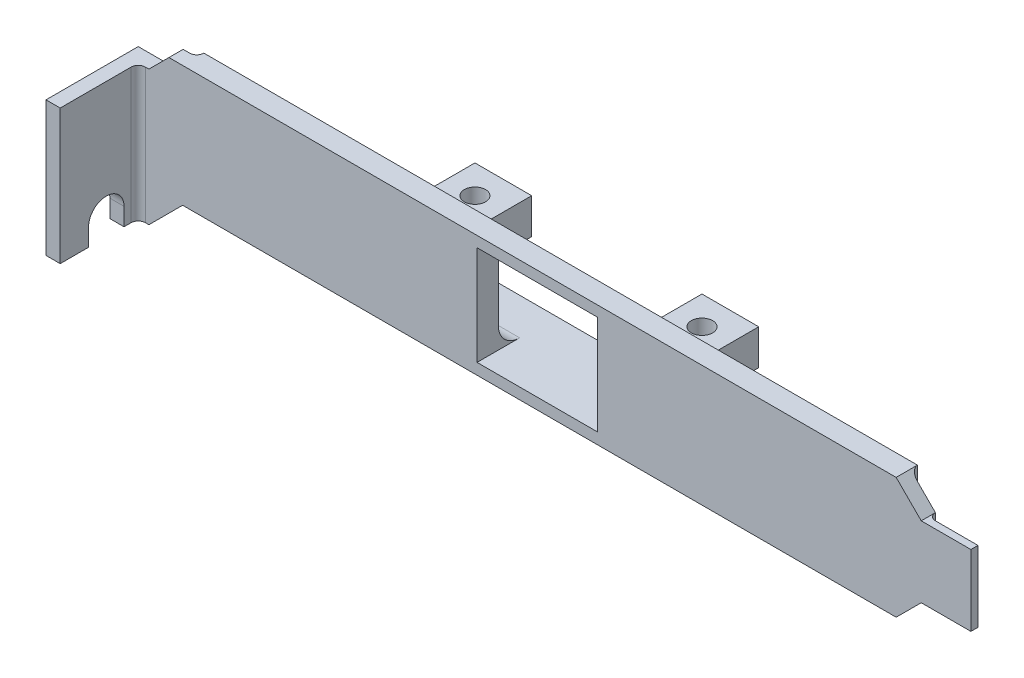
from build123d import *

# Parameters (mm, degrees)
CUT_EXTRUDE_1_DEPTH       = 2
CUT_EXTRUDE_START         = 9
CUT_EXTRUDE_1_2_OUTLINE_W = 2
CUT_EXTRUDE_1_2_OUTLINE_H = 19
CUT_EXTRUDE_1_2_DEPTH     = 4
CUT_EXTRUDE_START_2       = 2
CUT_EXTRUDE_1_3_OUTLINE_W = 2
CUT_EXTRUDE_1_3_OUTLINE_H = 19
CUT_EXTRUDE_1_3_DEPTH     = 2
CUT_EXTRUDE_START_3       = -49.585786703
CUT_EXTRUDE_1_4_DEPTH     = 2
CUT_EXTRUDE_START_4       = -5.128602194
CUT_EXTRUDE_1_5_DEPTH     = 19
SKETCH_3_W                = 100.571067812
SKETCH_3_H                = 17.071067812
EXTRUDE_1_DEPTH           = 1
CUT_EXTRUDE_2_REACH       = 75.102
SKETCH_4_W                = 17
SKETCH_4_H                = 14
SKETCH_5_W                = 8
SKETCH_5_H                = 5
SKETCH_5_W_2              = 47
SKETCH_5_H_2              = 1.571067812
EXTRUDE_2_DEPTH           = 8.2
CUT_EXTRUDE_3_REACH       = 75.563
SKETCH_6_R                = 1.5
FILLET_1_R                = 1
FILLET_2_R                = 3
SKETCH_8_W                = 7
SKETCH_8_H                = 10
CUT_EXTRUDE_4_DEPTH       = 1
FILLET_3_R                = 1


with BuildPart() as part:
    # 切除-拉伸1: read off the stored shape, not the designer's step
    # 切除-拉伸1 outline → 切除-拉伸1 (new body)
    with BuildSketch(Plane.XY):
        Polygon((-49.585786703, 13.871397806), (-49.585786703, -5.128602194), (-46.085786703, -5.128602194), (-41.32842739, -0.371242882), (59.242640422, -0.371242882), (62.778174328, 3.164291024), (69.778174328, 3.164291024), (69.778174328, 13.164291024), (62.778174328, 13.164291024), (59.242640422, 16.69982493), (-43.257359578, 16.69982493), (-46.085786703, 13.871397806), align=None)
    extrude(amount=CUT_EXTRUDE_1_DEPTH)

    # Cut-Extrude 1 3 outline → Cut-Extrude 1 3 (add)
    with BuildSketch(Plane.XY.offset(CUT_EXTRUDE_START_2)):
        with Locations((-48.585786703, 4.371397806)):
            Rectangle(CUT_EXTRUDE_1_3_OUTLINE_W, CUT_EXTRUDE_1_3_OUTLINE_H)
    extrude(amount=CUT_EXTRUDE_1_3_DEPTH)



with BuildPart() as body_2:
    # Cut-Extrude 1 2 outline → Cut-Extrude 1 2 (new body)
    with BuildSketch(Plane.XY.offset(CUT_EXTRUDE_START)):
        with Locations((-48.585786703, 4.371397806)):
            Rectangle(CUT_EXTRUDE_1_2_OUTLINE_W, CUT_EXTRUDE_1_2_OUTLINE_H)
    extrude(amount=CUT_EXTRUDE_1_2_DEPTH)


with BuildPart() as part_1:
    add(part.part)

    add(body_2.part)  # Cut-Extrude 1 4 merges body 2
    # Cut-Extrude 1 4 outline → Cut-Extrude 1 4 (add)
    with BuildSketch(Plane.YZ.offset(CUT_EXTRUDE_START_3)):
        with BuildLine():
            Line((13.871397806, 9), (-2.628602194, 9))
            ThreePointArc((-2.628602194, 9), (-0.128602194, 6.5), (-2.628602194, 4))
            Line((-2.628602194, 4), (13.871397806, 4))
            Line((13.871397806, 4), (13.871397806, 9))
        make_face()
    extrude(amount=CUT_EXTRUDE_1_4_DEPTH)

    # Cut-Extrude 1 5 outline → Cut-Extrude 1 5 (add)
    with BuildSketch(Plane(origin=(0, 0, 0), x_dir=(1, 0, 0), z_dir=(0, 1, 0)).offset(CUT_EXTRUDE_START_4)):
        with BuildLine():
            ThreePointArc((-47.585786703, -3), (-47.292893484, -2.292893219), (-46.585786703, -2))
            Line((-46.585786703, -2), (-47.585786703, -2))
            Line((-47.585786703, -2), (-47.585786703, -3))
        make_face()
    extrude(amount=CUT_EXTRUDE_1_5_DEPTH)

    # 草图3 → 凸台-拉伸1 (add)
    with BuildSketch(Plane(origin=(0, 0, 0), x_dir=(-1, 0, 0), z_dir=(0, 0, -1))):
        with Locations((-8.957106516, 8.164291024)):
            Rectangle(SKETCH_3_W, SKETCH_3_H)
    extrude(amount=EXTRUDE_1_DEPTH)

    # 草图4 → 切除-拉伸2 (cut, up to next)
    with BuildSketch(Plane(origin=(0, 0, -1), x_dir=(-1, 0, 0), z_dir=(0, 0, -1)), mode=Mode.PRIVATE) as cut_extrude_2_sk1:
        with Locations((-8.67157261, 8.19982493)):
            Rectangle(SKETCH_4_W, SKETCH_4_H)
    cut_extrude_2_tool1 = extrude(cut_extrude_2_sk1.sketch, amount=-CUT_EXTRUDE_2_REACH, mode=Mode.PRIVATE) & part_1.part
    add(cut_extrude_2_tool1.solids().sort_by_distance((8.671573, 8.199825, -1))[0], mode=Mode.SUBTRACT)

    # 草图5 → 凸台-拉伸2 (add)
    with BuildSketch(Plane(origin=(0, 0, -1), x_dir=(-1, 0, 0), z_dir=(0, 0, -1))):
        with Locations((-24.67157261, 11.69982493)):
            Rectangle(SKETCH_5_W, SKETCH_5_H)
        with Locations((7.32842739, 11.69982493)):
            Rectangle(SKETCH_5_W, SKETCH_5_H)
        with Locations((-8.67157261, 0.414291024)):
            Rectangle(SKETCH_5_W_2, SKETCH_5_H_2)
    extrude(amount=EXTRUDE_2_DEPTH)

    # 草图6 → 切除-拉伸3 (cut, up to next)
    with BuildSketch(Plane(origin=(0, 14.19982493, 0), x_dir=(1, 0, 0), z_dir=(0, 1, 0)), mode=Mode.PRIVATE) as cut_extrude_3_sk1:
        with Locations(Location((-7.32842739, 5.2, 0), (0, 0, 270))):
            Circle(SKETCH_6_R)
    cut_extrude_3_tool1 = extrude(cut_extrude_3_sk1.sketch, amount=-CUT_EXTRUDE_3_REACH, mode=Mode.PRIVATE) & part_1.part
    # 草图6 → 切除-拉伸3 (cut, up to next)
    with BuildSketch(Plane(origin=(0, 14.19982493, 0), x_dir=(1, 0, 0), z_dir=(0, 1, 0)), mode=Mode.PRIVATE) as cut_extrude_3_sk2:
        with Locations(Location((24.67157261, 5.2, 0), (0, 0, 270))):
            Circle(SKETCH_6_R)
    cut_extrude_3_tool2 = extrude(cut_extrude_3_sk2.sketch, amount=-CUT_EXTRUDE_3_REACH, mode=Mode.PRIVATE) & part_1.part
    add(cut_extrude_3_tool1.solids().sort_by_distance((-7.328427, 14.199825, -5.2))[0], mode=Mode.SUBTRACT)
    add(cut_extrude_3_tool2.solids().sort_by_distance((24.671573, 14.199825, -5.2))[0], mode=Mode.SUBTRACT)

    # 圆角1
    fillet_1_edges = [part_1.edges().sort_by_distance(p)[0] for p in [
        (59.242640422, 8.164291024, 0),
        (-41.32842739, 8.164291024, 0),
    ]]
    fillet(fillet_1_edges, radius=FILLET_1_R - 0.0001)  # a hair under: the kernel refuses the full size

    # 圆角2
    fillet_2_edges = [part_1.edges().sort_by_distance(p)[0] for p in [
        (-7.32842739, 1.19982493, -1),
        (24.67157261, 1.19982493, -1),
    ]]
    fillet(fillet_2_edges, radius=FILLET_2_R)

    # 草图8 → 切除-拉伸4 (cut)
    with BuildSketch(Plane(origin=(0, 0, 0), x_dir=(-1, 0, 0), z_dir=(0, 0, -1))):
        with Locations((-66.278174328, 8.164291024)):
            Rectangle(SKETCH_8_W, SKETCH_8_H)
    extrude(amount=-CUT_EXTRUDE_4_DEPTH, mode=Mode.SUBTRACT)

    # 圆角3
    fillet_3_edges = [part_1.edges().sort_by_distance(p)[0] for p in [
        (62.778174328, 8.164291024, 1),
    ]]
    fillet(fillet_3_edges, radius=FILLET_3_R - 0.0001)  # a hair under: the kernel refuses the full size


solid = part_1.part
